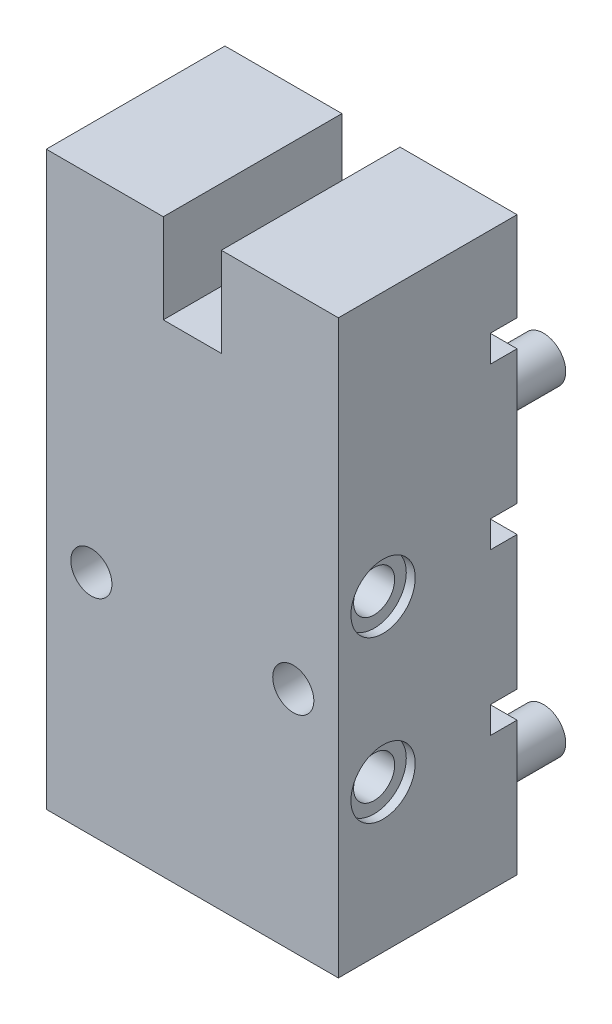
from build123d import *

# Parameters (mm, degrees)
EXTRUDE_1_DEPTH        = 54
EXTRUDE_2_DEPTH        = 10
SKETCH_3_W             = 6.5
SKETCH_3_H             = 20
CUT_EXTRUDE_1_DEPTH    = 10
EXTRUDE_3_DEPTH        = 15
EXTRUDE_4_DEPTH        = 15
PATTERN_LINEAR_6_COUNT = 2
PATTERN_LINEAR_6_PITCH = 18
SKETCH_8_W             = 3
SKETCH_8_H             = 3
CUT_EXTRUDE_2_DEPTH    = 73.562318045
SKETCH_9_R             = 2.5
EXTRUDE_5_DEPTH        = 8
OTHER_START            = -10
OTHER_1_OUTLINE_R      = 2.3
OTHER_1_DEPTH          = 20
OTHER_1_2_OUTLINE_R    = 3.6
OTHER_1_2_OUTLINE_R_2  = 2.3
OTHER_1_2_DEPTH        = 1


# Read off the part's stored shape, not the designer's step: 高级异型孔1, 高级异型孔2
with BuildPart() as part:
    # 草图1 → 凸台-拉伸1 (new body)
    with BuildSketch(Plane(origin=(0, 0, 0), x_dir=(1, 0, 0), z_dir=(0, 1, 0))):
        Polygon((-12.038834765, 10), (-16.35, 10), (-16.35, -10), (16.35, -10), (16.35, 10), (12.038834765, 10), (0, -2.038834765), align=None)
    extrude(amount=EXTRUDE_1_DEPTH)

    # 草图2 → 凸台-拉伸2 (add)
    with BuildSketch(Plane(origin=(0, 54, 0), x_dir=(1, 0, 0), z_dir=(0, 1, 0))):
        Polygon((16.35, 10), (12.038834765, 10), (0, -2.038834765), (-12.038834765, 10), (-16.35, 10), (-16.35, -10), (16.35, -10), align=None)
        Polygon((12.038834765, 10), (-12.038834765, 10), (0, -2.038834765), align=None)
    extrude(amount=EXTRUDE_2_DEPTH)

    # 草图3 → 切除-拉伸1 (cut)
    with BuildSketch(Plane(origin=(0, 64, 0), x_dir=(1, 0, 0), z_dir=(0, 1, 0))):
        Rectangle(SKETCH_3_W, SKETCH_3_H)
    extrude(amount=-CUT_EXTRUDE_1_DEPTH, mode=Mode.SUBTRACT)

    # 草图5 → 凸台-拉伸3 (add)
    with BuildSketch(Plane(origin=(0, 0, 0), x_dir=(-1, 0, 0), z_dir=(0, -1, 0))):
        Polygon((6.25, 4.211165235), (12.038834765, 10), (6.25, 10), align=None)
        Polygon((-6.25, 4.211165235), (-12.038834765, 10), (-6.25, 10), align=None)
    extrude(amount=-EXTRUDE_3_DEPTH)

    # 草图6 → 凸台-拉伸4 (add)
    with BuildSketch(Plane(origin=(0, 18, 0), x_dir=(1, 0, 0), z_dir=(0, 1, 0))):
        Polygon((12.038834765, 10), (6.25, 10), (6.25, 4.211165235), align=None)
        Polygon((-6.25, 4.211165235), (-12.038834765, 10), (-6.25, 10), align=None)
    extrude_4 = extrude(amount=EXTRUDE_4_DEPTH)

    # 阵列(线性)6: 凸台-拉伸4 ×2
    with Locations(*[(0, i * PATTERN_LINEAR_6_PITCH, 0) for i in range(1, PATTERN_LINEAR_6_COUNT)]):
        add(extrude_4)

    # 草图8 → 切除-拉伸2 (cut, through all)
    with BuildSketch(Plane(origin=(16.35, 0, 0), x_dir=(0, 0, -1), z_dir=(1, 0, 0))):
        with Locations((8.5, 52.5)):
            Rectangle(SKETCH_8_W, SKETCH_8_H)
        with Locations((8.5, 34.5)):
            Rectangle(SKETCH_8_W, SKETCH_8_H)
        with Locations((8.5, 16.5)):
            Rectangle(SKETCH_8_W, SKETCH_8_H)
    extrude(amount=-CUT_EXTRUDE_2_DEPTH, mode=Mode.SUBTRACT)

    # 草图9 → 凸台-拉伸5 (add)
    with BuildSketch(Plane(origin=(0, 0, -10), x_dir=(-1, 0, 0), z_dir=(0, 0, -1))):
        with Locations((-11.3, 43.5)):
            Circle(SKETCH_9_R)
        with Locations((11.3, 43.5)):
            Circle(SKETCH_9_R)
        with Locations(Location((11.3, 7.5, 0), (0, 0, 180))):
            Circle(SKETCH_9_R)
        with Locations(Location((-11.3, 7.5, 0), (0, 0, 180))):
            Circle(SKETCH_9_R)
    extrude(amount=EXTRUDE_5_DEPTH)

    # 高级异型孔1 outline → 高级异型孔1 (cut)
    with BuildSketch(Plane.XY.offset(OTHER_START)):
        with Locations((-11.3, 25.5)):
            Circle(OTHER_1_OUTLINE_R)
        with Locations((11.3, 25.5)):
            Circle(OTHER_1_OUTLINE_R)
    extrude(amount=OTHER_1_DEPTH, mode=Mode.SUBTRACT)

    # Other 1 2 outline → Other 1 2 (cut)
    # profile 1 of 2: a face of its own
    with BuildSketch(Plane.XY.offset(OTHER_START)):
        with Locations((-11.3, 25.5)):
            Circle(OTHER_1_2_OUTLINE_R)
        with Locations((-11.3, 25.5)):
            Circle(OTHER_1_2_OUTLINE_R_2, mode=Mode.SUBTRACT)
    # profile 2 of 2: a face of its own
    with BuildSketch(Plane.XY.offset(OTHER_START)):
        with Locations((11.3, 25.5)):
            Circle(OTHER_1_2_OUTLINE_R)
        with Locations((11.3, 25.5)):
            Circle(OTHER_1_2_OUTLINE_R_2, mode=Mode.SUBTRACT)
    extrude(amount=OTHER_1_2_DEPTH, mode=Mode.SUBTRACT)

    # 高级异型孔2 outline → 高级异型孔2 (revolve, cut)
    with BuildSketch(Plane(origin=(0, 34.5, 4.998489893), x_dir=(0, 1, 0), z_dir=(0, 0, -1))):
        Polygon((3.6, -16.35), (3.6, -15.35), (2.3, -15.35), (2.3, -5.35), (0, -3.96802058), (0, -16.35), align=None)
    other_2 = revolve(axis=Axis((0, 34.5, 4.998489893), (1, 0, 0)), mode=Mode.SUBTRACT)

    # Other 2 2 outline → Other 2 2 (revolve, cut)
    with BuildSketch(Plane(origin=(0, 16.5, 4.998489893), x_dir=(0, 1, 0), z_dir=(0, 0, -1))):
        Polygon((0, -16.35), (3.6, -16.35), (3.6, -15.35), (2.3, -15.35), (2.3, -5.35), (0, -3.96802058), align=None)
    other_2_2 = revolve(axis=Axis((0, 16.5, 4.998489893), (1, 0, 0)), mode=Mode.SUBTRACT)

    # 镜向1: 高级异型孔2, Other 2 2 across plane
    add(other_2.mirror(Plane(origin=(0, 0, 0), x_dir=(0, 0, 1), z_dir=(1, 0, 0))), mode=Mode.SUBTRACT)
    add(other_2_2.mirror(Plane(origin=(0, 0, 0), x_dir=(0, 0, 1), z_dir=(1, 0, 0))), mode=Mode.SUBTRACT)


solid = part.part
